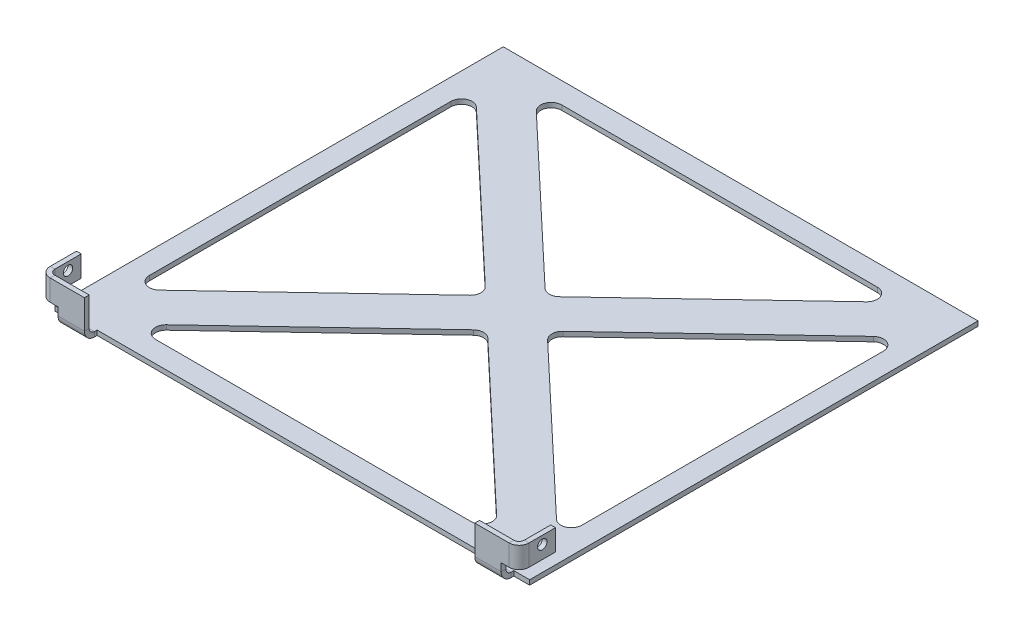
from build123d import *

# Parameters (mm, degrees)
BOSS_EXTRUDE1_DEPTH                 = 1.5
SKETCH3_W                           = 5
SKETCH3_H                           = 1.5
BOSS_EXTRUDE2_DEPTH                 = 6.5
BOSS_EXTRUDE3_DEPTH                 = 6
BOSS_EXTRUDE3_DEPTH_BACK            = 1.5
SKETCH4_W                           = 1.5
SKETCH4_H                           = 4
BOSS_EXTRUDE3_2_DEPTH               = 6
BOSS_EXTRUDE3_2_DEPTH_BACK          = 1.5
SKETCH5_W                           = 2.5
SKETCH5_H                           = 1.5
BOSS_EXTRUDE4_DEPTH                 = 4
CONVERT_SOLID2_DEPTH                = 0.6
CONVERT_SOLID2_START                = 0.6
CONVERT_SOLID2_2_DEPTH              = 7.4
CONVERT_SOLID2_3_OUTLINE_W          = 5
CONVERT_SOLID2_3_OUTLINE_H          = 0.9
CONVERT_SOLID2_3_DEPTH              = 0.15504
CONVERT_SOLID2_START_2              = 4
CONVERT_SOLID2_4_DEPTH              = 4
CONVERT_SOLID2_START_3              = -42
CONVERT_SOLID2_5_DEPTH              = 84
CONVERT_SOLID2_6_DEPTH              = 5
CONVERT_SOLID2_START_4              = 37
CONVERT_SOLID2_7_DEPTH              = 5
F_0_CLEARANCE_HOLE1_D               = 1.778
F_0_CLEARANCE_HOLE1_DEPTH           = 3.175
F_0_CLEARANCE_HOLE1_TIP             = 0.53416509
F_0_CLEARANCE_HOLE1_ON_FACE_2_D     = 1.778
F_0_CLEARANCE_HOLE1_ON_FACE_2_DEPTH = 3.175
F_0_CLEARANCE_HOLE1_ON_FACE_2_TIP   = 0.53416509
CUT_EXTRUDE1_DEPTH                  = 65.182707952


with BuildPart() as part:
    # Sketch1 → Boss-Extrude1 (new body)
    with BuildSketch(Plane(origin=(0, 0, 0), x_dir=(1, 0, 0), z_dir=(0, 1, 0))):
        Polygon((-42, -45.5), (-42, -42.5), (-45, -42.5), (-45, 42.5), (45, 42.5), (45, -42.5), (42, -42.5), (42, -45.5), (37, -45.5), (37, -42.5), (-37, -42.5), (-37, -45.5), align=None)
    extrude(amount=BOSS_EXTRUDE1_DEPTH)

    # Sketch3 → Boss-Extrude2 (add)
    with BuildSketch(Plane(origin=(0, 1.5, 0), x_dir=(1, 0, 0), z_dir=(0, 1, 0))):
        with Locations((-39.5, -44.75)):
            Rectangle(SKETCH3_W, SKETCH3_H)
        with Locations((39.5, -44.75)):
            Rectangle(SKETCH3_W, SKETCH3_H)
    extrude(amount=BOSS_EXTRUDE2_DEPTH)



with BuildPart() as body_2:
    # Sketch4 → Boss-Extrude3 (new, two sides: drawn at the far end of the back side and taken through both)
    with BuildSketch(Plane(origin=(0, 0, 44), x_dir=(-1, 0, 0), z_dir=(0, 0, -1)).offset(-BOSS_EXTRUDE3_DEPTH_BACK)):
        with Locations((45.25, 6)):
            Rectangle(SKETCH4_W, SKETCH4_H)
    extrude(amount=BOSS_EXTRUDE3_DEPTH + BOSS_EXTRUDE3_DEPTH_BACK)


with BuildPart() as body_3:
    # Sketch4 → Boss-Extrude3 2 (new, two sides: drawn at the far end of the back side and taken through both)
    with BuildSketch(Plane(origin=(0, 0, 44), x_dir=(-1, 0, 0), z_dir=(0, 0, -1)).offset(-BOSS_EXTRUDE3_2_DEPTH_BACK)):
        with Locations((-45.25, 6)):
            Rectangle(SKETCH4_W, SKETCH4_H)
    extrude(amount=BOSS_EXTRUDE3_2_DEPTH + BOSS_EXTRUDE3_2_DEPTH_BACK)


with BuildPart() as part_1:
    add(part.part)

    add(body_2.part)  # Boss-Extrude4 merges body 2

    add(body_3.part)  # Boss-Extrude4 merges body 3
    # Sketch5 → Boss-Extrude4 (add)
    with BuildSketch(Plane(origin=(0, 8, 0), x_dir=(1, 0, 0), z_dir=(0, 1, 0))):
        with Locations((-43.25, -44.75)):
            Rectangle(SKETCH5_W, SKETCH5_H)
        with Locations((43.25, -44.75)):
            Rectangle(SKETCH5_W, SKETCH5_H)
    extrude(amount=-BOSS_EXTRUDE4_DEPTH)

    # Convert-Solid2: read off the stored shape, not the designer's step
    # Convert-Solid2 outline → Convert-Solid2 (cut)
    with BuildSketch(Plane(origin=(0, 0, 0), x_dir=(1, 0, 0), z_dir=(0, 1, 0))):
        Polygon((37, -45.5), (42, -45.5), (42, -42.5), (45, -42.5), (45, 42.5), (-45, 42.5), (-45, -42.5), (-42, -42.5), (-42, -45.5), (-37, -45.5), (-37, -42.5), (37, -42.5), align=None)
    extrude(amount=CONVERT_SOLID2_DEPTH, mode=Mode.SUBTRACT)

    # Convert-Solid2 2 outline → Convert-Solid2 2 (cut)
    with BuildSketch(Plane(origin=(0, 0, 0), x_dir=(1, 0, 0), z_dir=(0, 1, 0)).offset(CONVERT_SOLID2_START)):
        with BuildLine():
            Line((37, -45.5), (46, -45.5))
            Line((46, -45.5), (46, -38))
            Line((46, -38), (45.4, -38))
            Line((45.4, -38), (45.4, -43))
            ThreePointArc((45.4, -43), (44.843502884, -44.343502884), (43.5, -44.9))
            Line((43.5, -44.9), (37, -44.9))
            Line((37, -44.9), (37, -45.5))
        make_face()
        with BuildLine():
            Line((-37, -45.5), (-37, -44.9))
            Line((-37, -44.9), (-43.5, -44.9))
            ThreePointArc((-43.5, -44.9), (-44.843502884, -44.343502884), (-45.4, -43))
            Line((-45.4, -43), (-45.4, -38))
            Line((-45.4, -38), (-46, -38))
            Line((-46, -38), (-46, -45.5))
            Line((-46, -45.5), (-37, -45.5))
        make_face()
    extrude(amount=CONVERT_SOLID2_2_DEPTH, mode=Mode.SUBTRACT)

    # Convert-Solid2 3 outline → Convert-Solid2 3 (cut)
    with BuildSketch(Plane(origin=(0, 0, 0), x_dir=(1, 0, 0), z_dir=(0, 1, 0)).offset(CONVERT_SOLID2_START)):
        with Locations((39.5, -44.45)):
            Rectangle(CONVERT_SOLID2_3_OUTLINE_W, CONVERT_SOLID2_3_OUTLINE_H)
        with Locations((-39.5, -44.45)):
            Rectangle(CONVERT_SOLID2_3_OUTLINE_W, CONVERT_SOLID2_3_OUTLINE_H)
    extrude(amount=CONVERT_SOLID2_3_DEPTH, mode=Mode.SUBTRACT)

    # Convert-Solid2 4 outline → Convert-Solid2 4 (add)
    with BuildSketch(Plane(origin=(0, 0, 0), x_dir=(1, 0, 0), z_dir=(0, 1, 0)).offset(CONVERT_SOLID2_START_2)):
        with BuildLine():
            ThreePointArc((44.5, -43), (44.207106781, -43.707106781), (43.5, -44))
            Line((43.5, -44), (44.5, -44))
            Line((44.5, -44), (44.5, -43))
        make_face()
        with BuildLine():
            Line((-44.5, -44), (-43.5, -44))
            ThreePointArc((-43.5, -44), (-44.207106781, -43.707106781), (-44.5, -43))
            Line((-44.5, -43), (-44.5, -44))
        make_face()
    extrude(amount=CONVERT_SOLID2_4_DEPTH)

    # Convert-Solid2 5 outline → Convert-Solid2 5 (cut)
    with BuildSketch(Plane.YZ.offset(CONVERT_SOLID2_START_3)):
        with BuildLine():
            ThreePointArc((0.6, 43), (1.156497116, 44.343502884), (2.5, 44.9))
            Line((2.5, 44.9), (0.75504, 44.9))
            Line((0.75504, 44.9), (0.75504, 44))
            Line((0.75504, 44), (0.6, 44))
            Line((0.6, 44), (0.6, 43))
        make_face()
    extrude(amount=CONVERT_SOLID2_5_DEPTH, mode=Mode.SUBTRACT)

    # Convert-Solid2 6 outline → Convert-Solid2 6 (add)
    with BuildSketch(Plane.YZ.offset(CONVERT_SOLID2_START_3)):
        with BuildLine():
            ThreePointArc((1.5, 43), (1.792893219, 43.707106781), (2.5, 44))
            Line((2.5, 44), (1.5, 44))
            Line((1.5, 44), (1.5, 43))
        make_face()
    extrude(amount=CONVERT_SOLID2_6_DEPTH)

    # Convert-Solid2 7 outline → Convert-Solid2 7 (add)
    with BuildSketch(Plane.YZ.offset(CONVERT_SOLID2_START_4)):
        with BuildLine():
            ThreePointArc((1.5, 43), (1.792893219, 43.707106781), (2.5, 44))
            Line((2.5, 44), (1.5, 44))
            Line((1.5, 44), (1.5, 43))
        make_face()
    extrude(amount=CONVERT_SOLID2_7_DEPTH)

    # #0 Clearance Hole1
    with Locations(Plane(origin=(-44.5, 6.5, 40.5), x_dir=(0, 0, 1), z_dir=(1, 0, 0))):
        with Locations((0, 0)):
            Hole(F_0_CLEARANCE_HOLE1_D / 2, depth=F_0_CLEARANCE_HOLE1_DEPTH)
            with Locations((0, 0, -(F_0_CLEARANCE_HOLE1_DEPTH + F_0_CLEARANCE_HOLE1_TIP / 2))):  # 118° drill point
                Cone(0, F_0_CLEARANCE_HOLE1_D / 2, F_0_CLEARANCE_HOLE1_TIP, mode=Mode.SUBTRACT)

    # #0 Clearance Hole1 on face 2
    with Locations(Plane(origin=(44.5, 6.5, 40.5), x_dir=(0, 0, -1), z_dir=(-1, 0, 0))):
        with Locations((0, 0)):
            Hole(F_0_CLEARANCE_HOLE1_ON_FACE_2_D / 2, depth=F_0_CLEARANCE_HOLE1_ON_FACE_2_DEPTH)
            with Locations((0, 0, -(F_0_CLEARANCE_HOLE1_ON_FACE_2_DEPTH + F_0_CLEARANCE_HOLE1_ON_FACE_2_TIP / 2))):  # 118° drill point
                Cone(0, F_0_CLEARANCE_HOLE1_ON_FACE_2_D / 2, F_0_CLEARANCE_HOLE1_ON_FACE_2_TIP, mode=Mode.SUBTRACT)

    # Sketch18 → Cut-Extrude1 (cut, through all)
    with BuildSketch(Plane(origin=(0, 1.5, 0), x_dir=(1, 0, 0), z_dir=(0, 1, 0))):
        with BuildLine():
            Line((-1.373247066, -6.798919297), (-31.281892899, -35.045973695))
            ThreePointArc((-31.281892899, -35.045973695), (-31.767146924, -37.238900328), (-29.908645833, -38.5))
            Line((-29.908645833, -38.5), (29.908645833, -38.5))
            ThreePointArc((29.908645833, -38.5), (31.767146924, -37.238900328), (31.281892899, -35.045973695))
            Line((31.281892899, -35.045973695), (1.373247066, -6.798919297))
            ThreePointArc((1.373247066, -6.798919297), (0, -6.252945602), (-1.373247066, -6.798919297))
        make_face()
        with BuildLine():
            Line((-7.365165925, 1.454026305), (-37.626752934, 30.034414036))
            ThreePointArc((-37.626752934, 30.034414036), (-39.791677292, 30.417027888), (-41, 28.580387731))
            Line((-41, 28.580387731), (-41, -28.580387731))
            ThreePointArc((-41, -28.580387731), (-39.791677292, -30.417027888), (-37.626752934, -30.034414036))
            Line((-37.626752934, -30.034414036), (-7.365165925, -1.454026305))
            ThreePointArc((-7.365165925, -1.454026305), (-6.73841299, 0), (-7.365165925, 1.454026305))
        make_face()
        with BuildLine():
            Line((7.365165925, 1.454026305), (37.626752934, 30.034414036))
            ThreePointArc((37.626752934, 30.034414036), (39.791677292, 30.417027888), (41, 28.580387731))
            Line((41, 28.580387731), (41, -28.580387731))
            ThreePointArc((41, -28.580387731), (39.791677292, -30.417027888), (37.626752934, -30.034414036))
            Line((37.626752934, -30.034414036), (7.365165925, -1.454026305))
            ThreePointArc((7.365165925, -1.454026305), (6.73841299, 0), (7.365165925, 1.454026305))
        make_face()
        with BuildLine():
            Line((-31.281892899, 35.045973695), (-1.373247066, 6.798919297))
            ThreePointArc((-1.373247066, 6.798919297), (0, 6.252945602), (1.373247066, 6.798919297))
            Line((1.373247066, 6.798919297), (31.281892899, 35.045973695))
            ThreePointArc((31.281892899, 35.045973695), (31.767146924, 37.238900328), (29.908645833, 38.5))
            Line((29.908645833, 38.5), (-29.908645833, 38.5))
            ThreePointArc((-29.908645833, 38.5), (-31.767146924, 37.238900328), (-31.281892899, 35.045973695))
        make_face()
    extrude(amount=-CUT_EXTRUDE1_DEPTH, mode=Mode.SUBTRACT)


solid = part_1.part
